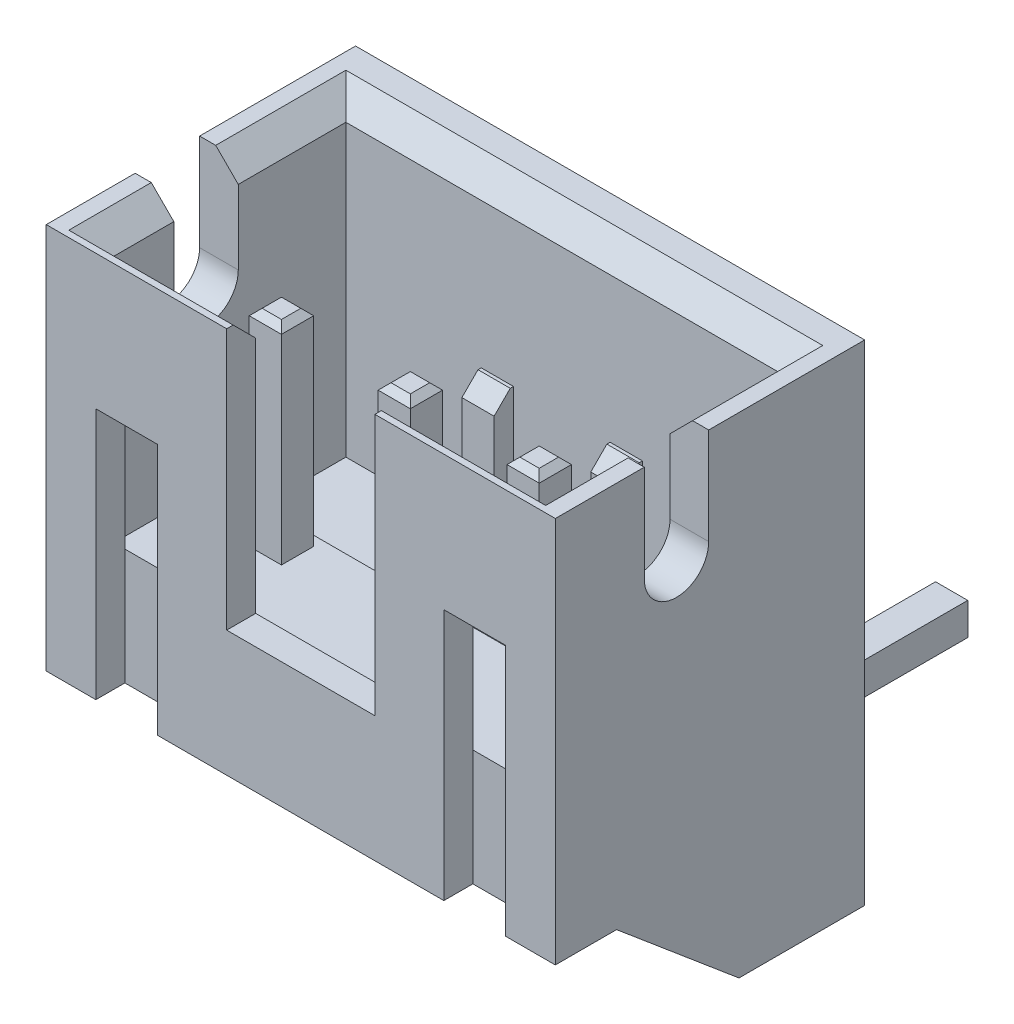
from build123d import *

# Parameters (mm, degrees)
BODY1_W                            = 7.9
BODY1_H                            = 4.8
EXTRUDE_1_DEPTH                    = 6
SKETCH_2_W                         = 6.7
SKETCH_2_H                         = 3.6
CUT_EXTRUDE_1_DEPTH                = 4.2
CHAMFER_1_SIZE                     = 0.35
SKETCH_4_W                         = 0.96
SKETCH_4_H                         = 3.91
CUT_EXTRUDE_3_DEPTH                = 0.45
SKETCH_5_W                         = 0.7
SKETCH_5_H                         = 3.45
CUT_EXTRUDE_4_DEPTH                = 0.4
CUT_EXTRUDE_6_REACH                = 13.02
SKETCH_8_W                         = 2.3
SKETCH_8_H                         = 4.05
CUT_EXTRUDE_7_REACH                = 13.02
SKETCH_15_W                        = 6.7
SKETCH_15_H                        = 1.95
CUT_EXTRUDE_9_DEPTH                = 0.65
CHAMFER_7_SIZE                     = 0.65
SKETCH_10_W                        = 0.5
SKETCH_10_H                        = 2.25
EXTRUDE_2_DEPTH                    = 0.3
CHAMFER_2_SIZE                     = 0.25
PATTERN_LINEAR_3_COUNT             = 2
PATTERN_LINEAR_3_PITCH             = 2
CHAMFER_2_OF_PATTERN_LINEAR_3_SIZE = 0.25
EXTRUDE_5_DEPTH                    = 0.95
SWEEP_START                        = 1.7
SWEEP_1_DEPTH                      = 0.5
CHAMFER_8_SIZE                     = 0.1
PATTERN_LINEAR_5_COUNT             = 3
PATTERN_LINEAR_5_PITCH             = 2
CHAMFER_8_OF_PATTERN_LINEAR_5_SIZE = 0.1
SKETCH_18_R                        = 0.05
CUT_EXTRUDE_10_DEPTH               = 3.4


# Read off the part's stored shape, not the designer's step: По траектории1
with BuildPart() as part:
    # Body1 → Бобышка-Вытянуть1 (new body)
    with BuildSketch(Plane(origin=(0, 0, 0), x_dir=(1, 0, 0), z_dir=(0, 1, 0))):
        with Locations((3.95, -2.4)):
            Rectangle(BODY1_W, BODY1_H)
    extrude(amount=EXTRUDE_1_DEPTH)

    # Эскиз2 → Вырез-Вытянуть1 (cut)
    with BuildSketch(Plane(origin=(0, 6, 0), x_dir=(1, 0, 0), z_dir=(0, 1, 0))):
        with Locations((3.95, -2.55)):
            Rectangle(SKETCH_2_W, SKETCH_2_H)
    extrude(amount=-CUT_EXTRUDE_1_DEPTH, mode=Mode.SUBTRACT)

    # Фаска1
    chamfer_1_edges = [part.edges().sort_by_distance(p)[0] for p in [
        (7.3, 6, 2.55),
        (3.95, 6, 0.75),
        (0.6, 6, 2.55),
        (3.95, 6, 4.35),
    ]]
    chamfer(chamfer_1_edges, length=CHAMFER_1_SIZE)

    # Эскиз4 → Вырез-Вытянуть3 (cut)
    with BuildSketch(Plane.XY.offset(4.8)):
        with Locations((1.25, 1.955)):
            Rectangle(SKETCH_4_W, SKETCH_4_H)
        with Locations((6.65, 1.955)):
            Rectangle(SKETCH_4_W, SKETCH_4_H)
    extrude(amount=-CUT_EXTRUDE_3_DEPTH, mode=Mode.SUBTRACT)

    # Эскиз5 → Вырез-Вытянуть4 (cut)
    with BuildSketch(Plane(origin=(0, 0, 4.8), x_dir=(1, 0, 0), z_dir=(0, 1, 0))):
        with Locations((1.95, 3.075)):
            Rectangle(SKETCH_5_W, SKETCH_5_H)
    cut_extrude_4 = extrude(amount=CUT_EXTRUDE_4_DEPTH, mode=Mode.SUBTRACT)

    # Эскиз8 → Вырез-Вытянуть6 (cut, up to next)
    with BuildSketch(Plane.XY.offset(4.8), mode=Mode.PRIVATE) as cut_extrude_6_sk1:
        with Locations((3.95, 3.975)):
            Rectangle(SKETCH_8_W, SKETCH_8_H)
    cut_extrude_6_tool1 = extrude(cut_extrude_6_sk1.sketch, amount=-CUT_EXTRUDE_6_REACH, mode=Mode.PRIVATE) & part.part
    add(cut_extrude_6_tool1.solids().sort_by_distance((3.95, 3.975, 4.8))[0], mode=Mode.SUBTRACT)

    # Эскиз9 → Вырез-Вытянуть7 (cut, up to next)
    with BuildSketch(Plane.ZY, mode=Mode.PRIVATE) as cut_extrude_7_sk1:
        with BuildLine():
            Line((2.42, 6), (3.42, 6))
            Line((3.42, 6), (3.42, 4.5))
            ThreePointArc((3.42, 4.5), (2.92, 4), (2.42, 4.5))
            Line((2.42, 4.5), (2.42, 6))
        make_face()
    cut_extrude_7_tool1 = extrude(cut_extrude_7_sk1.sketch, amount=-CUT_EXTRUDE_7_REACH, mode=Mode.PRIVATE) & part.part
    cut_extrude_7 = cut_extrude_7_tool1.solids().sort_by_distance((0, 5.05036, 2.92))[0]
    add(cut_extrude_7, mode=Mode.SUBTRACT)

    # Зеркальное отражение1: Вырез-Вытянуть7 across plane
    add(cut_extrude_7.mirror(Plane(origin=(3.95, 0, 0), x_dir=(0, 0, 1), z_dir=(1, 0, 0))), mode=Mode.SUBTRACT)

    # Эскиз15 → Вырез-Вытянуть9 (cut)
    with BuildSketch(Plane(origin=(0, 1.8, 0), x_dir=(1, 0, 0), z_dir=(0, 1, 0))):
        with Locations((3.95, -1.725)):
            Rectangle(SKETCH_15_W, SKETCH_15_H)
    extrude(amount=-CUT_EXTRUDE_9_DEPTH, mode=Mode.SUBTRACT)

    # Фаска7
    chamfer_7_edges = [part.edges().sort_by_distance(p)[0] for p in [
        (3.95, 1.15, 2.7),
    ]]
    chamfer(chamfer_7_edges, length=CHAMFER_7_SIZE - 0.0001)  # a hair under: the kernel refuses the full size

    # Эскиз10 → Бобышка-Вытянуть2 (add)
    with BuildSketch(Plane.XY.offset(0.75)):
        with Locations((2.95, 2.275)):
            Rectangle(SKETCH_10_W, SKETCH_10_H)
    extrude_2 = extrude(amount=EXTRUDE_2_DEPTH)

    # Фаска2
    chamfer_2_edges = [part.edges().sort_by_distance(p)[0] for p in [
        (2.95, 3.4, 1.05),
    ]]
    chamfer(chamfer_2_edges, length=CHAMFER_2_SIZE)

    # Линейный массив3: Бобышка-Вытянуть2 ×2
    with Locations(*[(i * PATTERN_LINEAR_3_PITCH, 0, 0) for i in range(1, PATTERN_LINEAR_3_COUNT)]):
        add(extrude_2)

    # Фаска2 of Линейный массив3
    chamfer_2_of_pattern_linear_3_edges = [part.edges().sort_by_distance(p)[0] for p in [
        (4.95, 3.4, 1.05),
    ]]
    chamfer(chamfer_2_of_pattern_linear_3_edges, length=CHAMFER_2_OF_PATTERN_LINEAR_3_SIZE)

    # Эскиз17 → Бобышка-Вытянуть5 (add)
    with BuildSketch(Plane.ZY):
        Polygon((0, -1.6), (1.95, -1.6), (3.85, 0), (0, 0), align=None)
    extrude_5 = extrude(amount=-EXTRUDE_5_DEPTH)

    # Зеркальное отражение3: Бобышка-Вытянуть5 across plane
    add(extrude_5.mirror(Plane(origin=(3.95, 0, 0), x_dir=(0, 0, 1), z_dir=(1, 0, 0))))

    # По траектории1 outline → По траектории1 (add)
    with BuildSketch(Plane.YZ.offset(SWEEP_START)):
        with BuildLine():
            add(Edge.make_bspline(
                [(-0.5, 2.45), (-0.5, 2.683362296), (-0.405057001, 2.917735205), (-0.152065654, 3.170726552), (-0.050887811, 3.237723146), (0.166472235, 3.327081743), (0.298557942, 3.349954697), (0.4, 3.35)],
                knots=[0.50998091, 0.50998091, 0.50998091, 0.50998091, 0.55448514, 0.55448514, 0.576737255, 0.576737255, 0.59898937, 0.59898937, 0.59898937, 0.59898937], degree=3))
            Line((-0.5, 2.45), (-0.5, -3.4))
            Line((-0.5, -3.4), (0, -3.4))
            Line((0, -3.4), (0, 2.45))
            add(Edge.make_bspline(
                [(0, 2.45), (0, 2.553716576), (0.042196888, 2.657882313), (0.154637487, 2.770322912), (0.199605417, 2.800099176), (0.296209882, 2.839814108), (0.331279974, 2.849979865), (0.4, 2.85)],
                knots=[0.50998091, 0.50998091, 0.50998091, 0.50998091, 0.55448514, 0.55448514, 0.576737255, 0.576737255, 0.59898937, 0.59898937, 0.59898937, 0.59898937], degree=3))
            Line((0.4, 2.85), (0.4, 3.35))
        make_face()
        with BuildLine():
            Line((1.8, 3.35), (1.8, 2.85))
            add(Edge.make_bspline(
                [(1.8, 2.85), (2.1, 2.85), (2.4, 2.85), (3.466666667, 2.85), (4.233333333, 2.85), (5, 2.85)],
                knots=[0.721036083, 0.721036083, 0.721036083, 0.721036083, 0.799494685, 0.799494685, 1, 1, 1, 1], degree=3))
            Line((5, 2.85), (5, 3.35))
            add(Edge.make_bspline(
                [(1.8, 3.35), (2.1, 3.35), (2.4, 3.35), (3.466666667, 3.35), (4.233333333, 3.35), (5, 3.35)],
                knots=[0.721036083, 0.721036083, 0.721036083, 0.721036083, 0.799494685, 0.799494685, 1, 1, 1, 1], degree=3))
        make_face()
    sweep_1 = extrude(amount=SWEEP_1_DEPTH)

    # Фаска8
    chamfer_8_edges = [part.edges().sort_by_distance(p)[0] for p in [
        (1.95, 5, 2.85),
        (2.2, 5, 3.1),
        (1.95, 5, 3.35),
        (1.7, 5, 3.1),
        (1.95, -0.5, -3.4),
        (2.2, -0.25, -3.4),
        (1.95, 0, -3.4),
        (1.7, -0.25, -3.4),
    ]]
    chamfer(chamfer_8_edges, length=CHAMFER_8_SIZE)

    # Линейный массив5: Вырез-Вытянуть4, По траектории1 ×3
    with Locations(*[(i * PATTERN_LINEAR_5_PITCH, 0, 0) for i in range(1, PATTERN_LINEAR_5_COUNT)]):
        add(cut_extrude_4, mode=Mode.SUBTRACT)
        add(sweep_1)

    # Фаска8 of Линейный массив5
    chamfer_8_of_pattern_linear_5_edges = [part.edges().sort_by_distance(p)[0] for p in [
        (3.95, 5, 2.85),
        (4.2, 5, 3.1),
        (3.95, 5, 3.35),
        (3.7, 5, 3.1),
        (3.95, -0.5, -3.4),
        (4.2, -0.25, -3.4),
        (3.95, 0, -3.4),
        (3.7, -0.25, -3.4),
        (5.95, 5, 2.85),
        (6.2, 5, 3.1),
        (5.95, 5, 3.35),
        (5.7, 5, 3.1),
        (5.95, -0.5, -3.4),
        (6.2, -0.25, -3.4),
        (5.95, 0, -3.4),
        (5.7, -0.25, -3.4),
    ]]
    chamfer(chamfer_8_of_pattern_linear_5_edges, length=CHAMFER_8_OF_PATTERN_LINEAR_5_SIZE)

    # Эскиз18 → Вырез-Вытянуть10 (cut)
    with BuildSketch(Plane(origin=(0, 0, 0), x_dir=(-1, 0, 0), z_dir=(0, 0, -1))):
        with Locations(Location((-1.95, -0.25, 0), (0, 0, 90))):
            Circle(SKETCH_18_R)
    extrude(amount=CUT_EXTRUDE_10_DEPTH, mode=Mode.SUBTRACT)


solid = part.part
